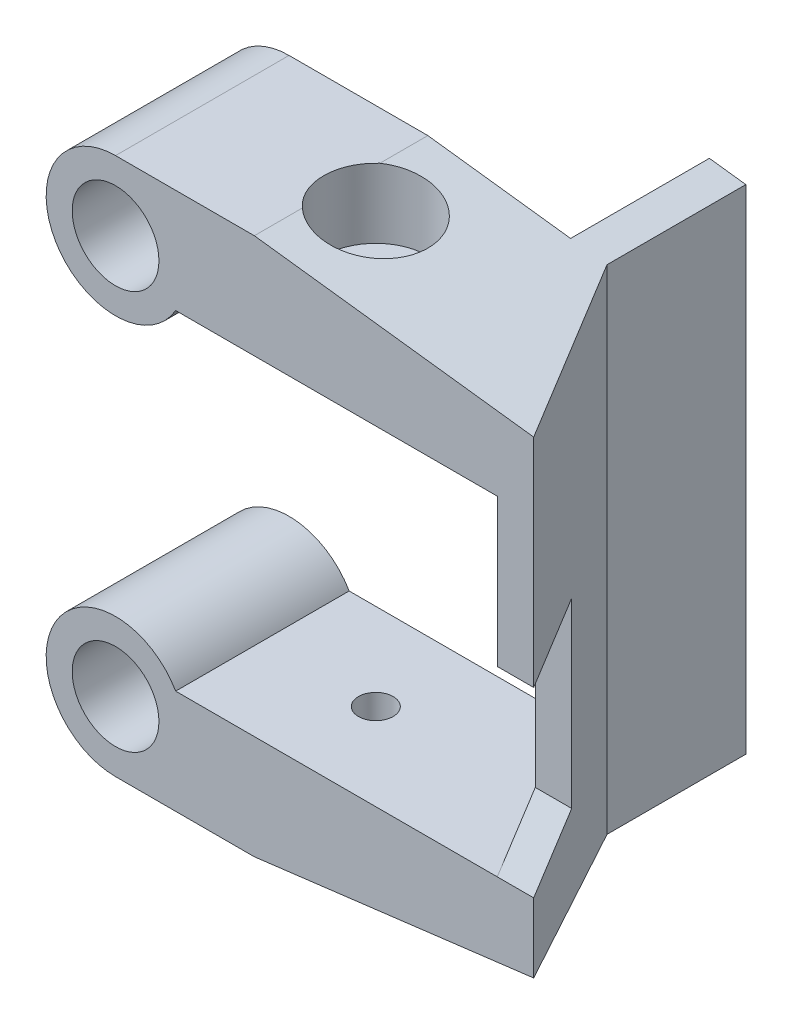
from build123d import *

# Parameters (mm, degrees)
CROQUIS1_R              = 2.5
SALIENTE_EXTRUIR1_DEPTH = 10
CROQUIS2_R              = 1
CORTAR_EXTRUIR1_DEPTH   = 4
CROQUIS3_R              = 3
CORTAR_EXTRUIR2_DEPTH   = 2
SALIENTE_EXTRUIR2_DEPTH = 13.5
SALIENTE_EXTRUIR3_START = 2
CROQUIS6_R              = 3
SALIENTE_EXTRUIR3_DEPTH = 2
CORTAR_EXTRUIR3_DEPTH   = 10
SALIENTE_EXTRUIR4_DEPTH = 8
CORTAR_EXTRUIR4_START   = 19.005770124
CORTAR_EXTRUIR4_DEPTH   = 5.094229876
CORTAR_EXTRUIR5_DEPTH   = 1


# Read off the part's stored shape, not the designer's step: Cortar-Extruir4
with BuildPart() as part:
    # Croquis1 → Saliente-Extruir1 (new body)
    with BuildSketch(Plane.XY):
        with BuildLine():
            Line((3.464101615, 3.5), (22, 3.5))
            Line((22, 3.5), (22, -0.5))
            Line((22, -0.5), (6, -0.5))
            Line((6, -0.5), (6, -2.5))
            Line((6, -2.5), (0, -2.5))
            ThreePointArc((0, -2.5), (-3.464101615, 3.5), (3.464101615, 3.5))
        make_face()
        with Locations((0, 1.5)):
            Circle(CROQUIS1_R, mode=Mode.SUBTRACT)
    extrude(amount=SALIENTE_EXTRUIR1_DEPTH)

    # Croquis2 → Cortar-Extruir1 (cut)
    with BuildSketch(Plane.XZ.offset(0.5)):
        with Locations(Location((10, 5, 0), (0, 0, 270))):
            Circle(CROQUIS2_R)
        Polygon((22, 10), (16.226497308, 0), (22, 0), align=None)
    extrude(amount=-CORTAR_EXTRUIR1_DEPTH, mode=Mode.SUBTRACT)

    # Croquis3 → Cortar-Extruir2 (cut)
    with BuildSketch(Plane.XZ.offset(0.5)):
        with Locations(Location((10, 5, 0), (0, 0, 270))):
            Circle(CROQUIS3_R)
    extrude(amount=-CORTAR_EXTRUIR2_DEPTH, mode=Mode.SUBTRACT)

    # Croquis4 → Saliente-Extruir2 (add)
    with BuildSketch(Plane.XZ.offset(0.5)):
        Polygon((22, 10), (24.1, 10), (18.326497308, 0), (16.226497308, 0), align=None)
    extrude(amount=-SALIENTE_EXTRUIR2_DEPTH)

    # Croquis6 → Saliente-Extruir3 (add)
    with BuildSketch(Plane.XZ.offset(0.5).offset(SALIENTE_EXTRUIR3_START)):
        Polygon((6, 10), (6, 0), (18.326497308, 0), (24.1, 10), align=None)
        with Locations(Location((10, 5, 0), (0, 0, 270))):
            Circle(CROQUIS6_R, mode=Mode.SUBTRACT)
    extrude(amount=-SALIENTE_EXTRUIR3_DEPTH)

    # Croquis7 → Cortar-Extruir3 (cut)
    with BuildSketch(Plane.XY.offset(10)):
        Polygon((24.1, -0.5), (8, -2.5), (24.1, -2.5), align=None)
    extrude(amount=-CORTAR_EXTRUIR3_DEPTH, mode=Mode.SUBTRACT)

    # Croquis8 → Saliente-Extruir4 (add)
    with BuildSketch(Plane(origin=(0, 0, 0), x_dir=(-1, 0, 0), z_dir=(0, 0, -1))):
        Polygon((-16.226497308, 13), (-18.326497308, 13), (-18.326497308, -1.217205303), (-16.226497308, -1.478074869), align=None)
    extrude(amount=SALIENTE_EXTRUIR4_DEPTH)

    # Simetría1: part across plane


with BuildPart() as part_1:
    add(part.part)
    add(part.part.mirror(Plane.ZX.offset(13)))

    # Cortar-Extruir4 outline → Cortar-Extruir4 (cut)
    with BuildSketch(Plane.YZ.offset(CORTAR_EXTRUIR4_START)):
        Polygon((3.871954022, 4.813841725), (14.371954022, 4.813841725), (14, 10), (3.5, 10), align=None)
    extrude(amount=CORTAR_EXTRUIR4_DEPTH, mode=Mode.SUBTRACT)

    # Croquis10 → Cortar-Extruir5 (cut)
    # profile 1 of 3: a face of its own
    with BuildSketch(Plane.XZ.offset(2.5)):
        with BuildLine():
            Line((0.93893851, 8.061465511), (0.624835946, 8.061465511))
            add(Edge.make_bspline(
                [(0.624835946, 8.061465511), (0.629974339, 8.091008734), (0.640098474, 8.149217504), (0.663168518, 8.233619406), (0.693890136, 8.31334783), (0.729855851, 8.389374725), (0.77397113, 8.460341308), (0.823569151, 8.527515757), (0.881199455, 8.589213597), (0.943781652, 8.647142725), (1.011267113, 8.699749333), (1.083372869, 8.74442066), (1.157885638, 8.783469404), (1.235775022, 8.815163541), (1.31697886, 8.838710682), (1.400592637, 8.85642678), (1.48740102, 8.867224), (1.54631294, 8.868506113), (1.576258221, 8.869157819)],
                knots=[0, 0, 0, 0, 1.053304757, 2.075317675, 3.068179183, 4.052514018, 5.025721787, 5.999656851, 6.981831287, 7.987213101, 8.994102963, 9.982949043, 10.963611807, 11.947192756, 12.931972798, 13.930523328, 14.948072636, 16, 16, 16, 16], degree=3))
            add(Edge.make_bspline(
                [(1.576258221, 8.869157819), (1.607849412, 8.868337596), (1.669858711, 8.866727609), (1.760664018, 8.85442526), (1.84726396, 8.835237206), (1.929477522, 8.806775963), (2.007089599, 8.770284416), (2.080961345, 8.72633159), (2.150619484, 8.674519652), (2.21443137, 8.614026389), (2.273438454, 8.548590787), (2.325098871, 8.477592336), (2.367371584, 8.401308099), (2.404054713, 8.321765516), (2.431060952, 8.236909756), (2.450848297, 8.147774097), (2.461883194, 8.05402824), (2.463669481, 7.990211824), (2.464579535, 7.957699485)],
                knots=[0, 0, 0, 0, 1.062315377, 2.085183558, 3.076853664, 4.041450855, 5.005054491, 5.956881831, 6.928532668, 7.918549963, 8.909565511, 9.889228988, 10.864308296, 11.838912148, 12.830831495, 13.853185998, 14.906269772, 16, 16, 16, 16], degree=3))
            add(Edge.make_bspline(
                [(2.464579535, 7.957699485), (2.463116795, 7.915300966), (2.460274509, 7.832915369), (2.437793048, 7.714206426), (2.399556512, 7.605209763), (2.354841164, 7.522096328), (2.310374191, 7.460727421), (2.271557279, 7.415828038), (2.227393375, 7.371636324), (2.177390877, 7.328856679), (2.121657913, 7.287495806), (2.060599984, 7.247148694), (1.99461627, 7.206562654), (1.947553936, 7.182191469), (1.92331351, 7.169638588)],
                knots=[0, 0, 0, 0, 1.499598844, 2.913907084, 4.255683563, 5.573052951, 6.236393449, 6.934250511, 7.671053759, 8.445154725, 9.260560518, 10.125260916, 11.034376938, 12, 12, 12, 12], degree=3))
            add(Edge.make_bspline(
                [(1.92331351, 7.169638588), (1.959233109, 7.145233398), (2.029395336, 7.097562418), (2.121912212, 7.013455328), (2.199538538, 6.921370005), (2.264524206, 6.822750081), (2.313572277, 6.715412989), (2.34974653, 6.60110216), (2.370969298, 6.478884654), (2.373528778, 6.394981352), (2.374835946, 6.352130575)],
                knots=[0, 0, 0, 0, 1.064624726, 2.079545519, 3.056122326, 4.013672591, 4.968126873, 5.942090367, 6.948992187, 8, 8, 8, 8], degree=3))
            add(Edge.make_bspline(
                [(2.374835946, 6.352130575), (2.372951048, 6.300812434), (2.36922834, 6.199458148), (2.339403877, 6.050347696), (2.290644048, 5.907158178), (2.223486846, 5.770520785), (2.138635562, 5.643878593), (2.038496205, 5.529007813), (1.922317264, 5.428948838), (1.792905422, 5.343764731), (1.653463441, 5.275250986), (1.506916129, 5.225768888), (1.354806806, 5.195153842), (1.251313153, 5.191510381), (1.199054696, 5.189670639)],
                knots=[0, 0, 0, 0, 1.004874671, 1.984646221, 2.966438109, 3.961709977, 4.958676373, 5.945134406, 6.938497793, 7.953256374, 8.973116323, 9.973725145, 10.976845487, 12, 12, 12, 12], degree=3))
            add(Edge.make_bspline(
                [(1.199054696, 5.189670639), (1.165832854, 5.190507601), (1.100573883, 5.192151679), (1.004559463, 5.204274263), (0.91247804, 5.224446776), (0.824180744, 5.253411912), (0.739975204, 5.290705099), (0.659339856, 5.335857332), (0.582972319, 5.389378235), (0.510561471, 5.450257408), (0.444148699, 5.518902365), (0.38427227, 5.594281029), (0.331495652, 5.67602942), (0.285883283, 5.764111158), (0.247186821, 5.858136921), (0.216630047, 5.958748464), (0.191662112, 6.065265565), (0.181374125, 6.13911863), (0.176117997, 6.176850126)],
                knots=[0, 0, 0, 0, 1.015592156, 1.994967694, 2.953714725, 3.89374535, 4.831137841, 5.76533834, 6.714853956, 7.678276274, 8.653576723, 9.630054425, 10.617115938, 11.623871201, 12.658910274, 13.721192194, 14.835758172, 16, 16, 16, 16], degree=3))
            Line((0.176117997, 6.176850126), (0.490220561, 6.176850126))
            add(Edge.make_bspline(
                [(0.490220561, 6.176850126), (0.497040066, 6.137680467), (0.509892115, 6.063861265), (0.538014089, 5.961531168), (0.570954337, 5.873556315), (0.611701031, 5.799048393), (0.661176422, 5.735216424), (0.719783483, 5.679156323), (0.788329897, 5.628889807), (0.864972279, 5.584979951), (0.947647633, 5.548083284), (1.034249656, 5.523879086), (1.122141028, 5.506036602), (1.181668268, 5.504531765), (1.211674888, 5.503773203)],
                knots=[0, 0, 0, 0, 1.310091687, 2.469000878, 3.493463796, 4.400459837, 5.257309936, 6.145490497, 7.065451012, 8.052643887, 9.053215749, 10.040649124, 11.012326184, 12, 12, 12, 12], degree=3))
            add(Edge.make_bspline(
                [(1.211674888, 5.503773203), (1.238597511, 5.504602376), (1.291773607, 5.506240114), (1.370450603, 5.518713672), (1.447016827, 5.538298922), (1.521916955, 5.565644483), (1.594356841, 5.602066821), (1.665280581, 5.645276658), (1.733536607, 5.697299459), (1.799494815, 5.755319564), (1.860068549, 5.818798356), (1.913814327, 5.884758638), (1.958972289, 5.952665305), (1.996883838, 6.021985519), (2.024341568, 6.094237738), (2.046210619, 6.167129776), (2.058116823, 6.242365936), (2.059856347, 6.292965433), (2.060733382, 6.318476729)],
                knots=[0, 0, 0, 0, 0.998765887, 1.972707914, 2.948771611, 3.928374012, 4.925217491, 5.953083336, 7.006002037, 8.105848567, 9.210029586, 10.258437752, 11.259122355, 12.233064382, 13.183315866, 14.122098927, 15.053198292, 16, 16, 16, 16], degree=3))
            add(Edge.make_bspline(
                [(2.060733382, 6.318476729), (2.059522921, 6.351280565), (2.057124568, 6.416276664), (2.037890817, 6.511589386), (2.004915129, 6.602440739), (1.960253791, 6.688491257), (1.903835241, 6.768053519), (1.834684637, 6.83724714), (1.755246554, 6.897149426), (1.663368987, 6.945702691), (1.55864559, 6.983705207), (1.439986475, 7.01058645), (1.306519998, 7.026430341), (1.21265571, 7.028385903), (1.163297484, 7.029414229)],
                knots=[0, 0, 0, 0, 0.91172544, 1.806453237, 2.690400502, 3.591501907, 4.495060705, 5.391179975, 6.301027311, 7.251780241, 8.269539355, 9.39038931, 10.627744823, 12, 12, 12, 12], degree=3))
            Line((1.163297484, 7.029414229), (1.201158061, 7.343516793))
            Line((1.201158061, 7.343516793), (1.293706138, 7.340712306))
            add(Edge.make_bspline(
                [(1.293706138, 7.340712306), (1.324811868, 7.341178226), (1.385761775, 7.342091169), (1.475077644, 7.35138343), (1.559901485, 7.366738652), (1.640108279, 7.387741218), (1.715622717, 7.414220123), (1.786280526, 7.44743607), (1.852291997, 7.486939984), (1.913684775, 7.531369364), (1.968915048, 7.580397423), (2.017506686, 7.632116807), (2.058591616, 7.686673267), (2.092526981, 7.743112995), (2.117845607, 7.80253954), (2.137066983, 7.863471046), (2.148690203, 7.927343696), (2.149875586, 7.970739426), (2.150476971, 7.992755575)],
                knots=[0, 0, 0, 0, 1.24628212, 2.442018811, 3.593922291, 4.698034728, 5.761554064, 6.796478033, 7.821307851, 8.840472263, 9.829094753, 10.776759556, 11.679673515, 12.561550013, 13.408929098, 14.262137482, 15.118322481, 16, 16, 16, 16], degree=3))
            add(Edge.make_bspline(
                [(2.150476971, 7.992755575), (2.149879643, 8.012172686), (2.148708953, 8.050227808), (2.141207508, 8.106314914), (2.126751398, 8.159707011), (2.107933167, 8.210950127), (2.084015792, 8.260171058), (2.05339587, 8.306215709), (2.018256976, 8.350816229), (1.977717433, 8.39245815), (1.933515781, 8.430681976), (1.886143137, 8.463770969), (1.836720561, 8.492121465), (1.784693356, 8.515504162), (1.729560582, 8.53290078), (1.672056357, 8.545412394), (1.61223344, 8.553350819), (1.571608636, 8.554481942), (1.551017837, 8.555055255)],
                knots=[0, 0, 0, 0, 1.017722485, 1.994609554, 2.957110515, 3.910372255, 4.852475095, 5.817233168, 6.802300924, 7.824362143, 8.857880086, 9.860231714, 10.847656914, 11.840006958, 12.84318132, 13.87138813, 14.921106966, 16, 16, 16, 16], degree=3))
            add(Edge.make_bspline(
                [(1.551017837, 8.555055255), (1.513243587, 8.553522788), (1.439376671, 8.550526074), (1.332798148, 8.524553384), (1.234376121, 8.481877703), (1.145539315, 8.423108063), (1.068727227, 8.350229513), (1.007322387, 8.26475368), (0.962853522, 8.167415855), (0.947042682, 8.097369313), (0.93893851, 8.061465511)],
                knots=[0, 0, 0, 0, 1.055739269, 2.064480543, 3.048501583, 4.044208126, 5.029380081, 5.994799901, 6.972193286, 8, 8, 8, 8], degree=3))
        make_face()
    # profile 2 of 3: a face of its own
    with BuildSketch(Plane.XZ.offset(2.5)):
        with BuildLine():
            add(Edge.make_bspline(
                [(4.355505016, 8.869157819), (4.388059863, 8.868069527), (4.452174428, 8.865926212), (4.546084688, 8.849259248), (4.636114186, 8.822600306), (4.721893143, 8.784634397), (4.80325974, 8.735154132), (4.881575795, 8.676542088), (4.954406772, 8.605227358), (5.023833004, 8.525051913), (5.087046416, 8.434618584), (5.14158594, 8.334205801), (5.18891997, 8.225299094), (5.226405985, 8.106766331), (5.255694149, 7.979663836), (5.276533299, 7.843513602), (5.289236946, 7.698527531), (5.290734177, 7.598751842), (5.291502612, 7.547543235)],
                knots=[0, 0, 0, 0, 0.862726717, 1.699081786, 2.520498053, 3.347202637, 4.178215295, 5.040763974, 5.93476699, 6.875030527, 7.849681161, 8.853576535, 9.899908318, 10.99336013, 12.144709661, 13.354978701, 14.642476391, 16, 16, 16, 16], degree=3))
            add(Edge.make_bspline(
                [(5.291502612, 7.547543235), (5.290873113, 7.48792938), (5.289630393, 7.370243338), (5.27844128, 7.196036781), (5.262390013, 7.026314147), (5.237343526, 6.861506232), (5.206768114, 6.701159816), (5.168931348, 6.545532105), (5.124141942, 6.394545984), (5.072313538, 6.249432554), (5.015983852, 6.112062685), (4.957281718, 5.983483243), (4.89474633, 5.866042629), (4.830722298, 5.757890303), (4.762162722, 5.661295934), (4.69274256, 5.573424163), (4.618471791, 5.497715654), (4.542605395, 5.431205347), (4.46425206, 5.374453633), (4.384960754, 5.324927813), (4.30402141, 5.283826665), (4.222455101, 5.248523157), (4.138565768, 5.222972575), (4.053718339, 5.204137373), (3.96747482, 5.191253787), (3.909404353, 5.190201071), (3.880144439, 5.189670639)],
                knots=[0, 0, 0, 0, 1.417840176, 2.799013713, 4.150912842, 5.471708405, 6.7625667, 8.032669517, 9.279703417, 10.506991142, 11.696233478, 12.810550062, 13.867435083, 14.859899853, 15.797607937, 16.683162267, 17.520520521, 18.316460938, 19.08034531, 19.819286053, 20.537807717, 21.237833669, 21.930604121, 22.619796651, 23.304558187, 24, 24, 24, 24], degree=3))
            add(Edge.make_bspline(
                [(3.880144439, 5.189670639), (3.836998162, 5.1913878), (3.752421184, 5.194753846), (3.629647003, 5.222286862), (3.514709871, 5.266793382), (3.425784602, 5.318432914), (3.359981415, 5.368653827), (3.312593927, 5.410839063), (3.268567491, 5.458209249), (3.22646348, 5.509514173), (3.186183674, 5.564950328), (3.149190381, 5.625679866), (3.114157939, 5.690674589), (3.081900383, 5.760453989), (3.052075978, 5.834856148), (3.027110654, 5.91485138), (3.006160797, 6.000141255), (2.9888237, 6.090494726), (2.974689216, 6.185903482), (2.964989903, 6.286522468), (2.95949358, 6.39249974), (2.958618066, 6.465004749), (2.958169279, 6.502170639)],
                knots=[0, 0, 0, 0, 1.435486142, 2.813894703, 4.16658029, 5.526677663, 6.22086169, 6.92078, 7.636484549, 8.371846828, 9.129958256, 9.916110108, 10.737818826, 11.587357994, 12.474660306, 13.405010476, 14.375161658, 15.397738152, 16.467494513, 17.58566334, 18.762416952, 20, 20, 20, 20], degree=3))
            add(Edge.make_bspline(
                [(2.958169279, 6.502170639), (2.958865674, 6.564116822), (2.960235698, 6.685984109), (2.970360627, 6.865826051), (2.986109, 7.039663223), (3.009073804, 7.207455853), (3.03967935, 7.368932488), (3.074965111, 7.524963437), (3.11761059, 7.675059131), (3.167466978, 7.818273174), (3.221759595, 7.953407837), (3.279380444, 8.079604938), (3.339910015, 8.196032674), (3.404482116, 8.302030016), (3.471833081, 8.398126528), (3.54278095, 8.483796956), (3.616461422, 8.560222791), (3.693787229, 8.626268002), (3.773613724, 8.682691864), (3.853281045, 8.733323779), (3.935141247, 8.77435652), (4.017171393, 8.809121265), (4.100426795, 8.836103417), (4.184753616, 8.854619434), (4.269805581, 8.867523895), (4.32694524, 8.868613305), (4.355505016, 8.869157819)],
                knots=[0, 0, 0, 0, 1.470791388, 2.893501234, 4.275600723, 5.614434664, 6.912857095, 8.17686219, 9.411686231, 10.615561684, 11.775855534, 12.868421853, 13.908428417, 14.889627493, 15.813393228, 16.692284126, 17.528148069, 18.331072678, 19.102586731, 19.8478506, 20.570031765, 21.273923614, 21.961841481, 22.644389209, 23.322433117, 24, 24, 24, 24], degree=3))
        make_face()
        with BuildLine():
            add(Edge.make_bspline(
                [(4.331666875, 8.555055255), (4.312692399, 8.554335183), (4.274498697, 8.552885752), (4.216987949, 8.542346785), (4.158617191, 8.526407312), (4.099329033, 8.50278295), (4.039549291, 8.472560878), (3.978520016, 8.436429583), (3.916971319, 8.393478294), (3.854524929, 8.344050338), (3.793356503, 8.286295246), (3.734454584, 8.220191684), (3.678121663, 8.145430069), (3.625035999, 8.061429946), (3.57377385, 7.968829499), (3.525719425, 7.867042696), (3.48020083, 7.756795691), (3.43764131, 7.638419264), (3.398295246, 7.512994087), (3.364946719, 7.380647543), (3.335978434, 7.242703344), (3.313470063, 7.098450591), (3.293857729, 6.948697019), (3.281987693, 6.792820217), (3.273919754, 6.631262547), (3.272827948, 6.521579004), (3.272271843, 6.465712306)],
                knots=[0, 0, 0, 0, 0.535590216, 1.078088953, 1.646503504, 2.242120821, 2.876684528, 3.536551845, 4.243209066, 4.994585865, 5.783597611, 6.615574094, 7.492013341, 8.4238755, 9.419375135, 10.479150357, 11.600588305, 12.786362483, 14.030464638, 15.311003394, 16.63899601, 18.009344201, 19.432868756, 20.902802065, 22.422459604, 24, 24, 24, 24], degree=3))
            add(Edge.make_bspline(
                [(3.272271843, 6.465712306), (3.272737165, 6.426195177), (3.273635908, 6.349870101), (3.282582447, 6.23923113), (3.294951715, 6.136228248), (3.314964073, 6.041478117), (3.339059573, 5.954189748), (3.369950634, 5.875211985), (3.405592361, 5.803505356), (3.447166989, 5.740266455), (3.492787274, 5.684797454), (3.541462394, 5.636638548), (3.592815964, 5.595897175), (3.646321147, 5.561633529), (3.702919027, 5.535391686), (3.762418731, 5.517347512), (3.824288709, 5.505546373), (3.866535277, 5.504367946), (3.887856779, 5.503773203)],
                knots=[0, 0, 0, 0, 1.484932994, 2.868063245, 4.170070992, 5.381165891, 6.504504114, 7.56970386, 8.563591869, 9.508896032, 10.407542569, 11.258515368, 12.077514383, 12.867109075, 13.641358872, 14.41376278, 15.199438864, 16, 16, 16, 16], degree=3))
            add(Edge.make_bspline(
                [(3.887856779, 5.503773203), (3.910105066, 5.504400054), (3.954653206, 5.505655208), (4.021012901, 5.517376097), (4.086453159, 5.536537197), (4.151244324, 5.562665455), (4.215518334, 5.596034703), (4.279351618, 5.636543931), (4.34169406, 5.685770608), (4.4040879, 5.74066751), (4.4643629, 5.80324407), (4.52172075, 5.872652307), (4.575797961, 5.948599354), (4.626153878, 6.031065088), (4.673958733, 6.119396622), (4.718004593, 6.214288529), (4.758863059, 6.315660137), (4.782827145, 6.386128677), (4.795108382, 6.422242755)],
                knots=[0, 0, 0, 0, 0.77604706, 1.553892808, 2.343877876, 3.152800139, 3.98830987, 4.868615572, 5.78728157, 6.75807329, 7.767676272, 8.816335789, 9.898351881, 11.019038633, 12.187032868, 13.402327443, 14.668731489, 16, 16, 16, 16], degree=3))
            add(Edge.make_bspline(
                [(4.795108382, 6.422242755), (4.809760777, 6.468632726), (4.839182801, 6.56178383), (4.87622479, 6.704026353), (4.906626079, 6.848757551), (4.933236689, 6.995453295), (4.952164185, 7.144836257), (4.967391568, 7.29628087), (4.975752044, 7.450225296), (4.976847653, 7.553610513), (4.977400048, 7.605736344)],
                knots=[0, 0, 0, 0, 0.97088093, 1.949529747, 2.93210591, 3.92216045, 4.924261898, 5.936559817, 6.959633308, 8, 8, 8, 8], degree=3))
            add(Edge.make_bspline(
                [(4.977400048, 7.605736344), (4.976883019, 7.644078768), (4.975882302, 7.718291053), (4.967593179, 7.826048559), (4.952967779, 7.926295192), (4.932719933, 8.019356512), (4.907033544, 8.105070908), (4.875524477, 8.183325642), (4.838305805, 8.254315485), (4.794785694, 8.317270339), (4.746855468, 8.372765819), (4.696212, 8.421429327), (4.64311105, 8.46335816), (4.586208523, 8.496401556), (4.52678098, 8.522765371), (4.464401297, 8.541569265), (4.398950746, 8.553328917), (4.354387061, 8.554472311), (4.331666875, 8.555055255)],
                knots=[0, 0, 0, 0, 1.430250887, 2.768270117, 4.028380119, 5.206661668, 6.318152812, 7.362403216, 8.349129852, 9.30195703, 10.210727286, 11.080171321, 11.919002126, 12.727940788, 13.528188044, 14.339050687, 15.153187666, 16, 16, 16, 16], degree=3))
        make_face(mode=Mode.SUBTRACT)
    # profile 3 of 3: a face of its own
    with BuildSketch(Plane.XZ.offset(2.5)):
        with BuildLine():
            add(Edge.make_bspline(
                [(6.539499407, 8.869157819), (6.562901292, 8.868430082), (6.609209602, 8.866990016), (6.67719874, 8.857195769), (6.742362302, 8.840305806), (6.804285148, 8.81618024), (6.863816543, 8.78578802), (6.920447327, 8.748640689), (6.974287912, 8.70472453), (7.024106434, 8.654334892), (7.070815613, 8.599402935), (7.110336265, 8.538662177), (7.145367844, 8.474508352), (7.173287951, 8.405826271), (7.194185464, 8.332847425), (7.209501625, 8.255941945), (7.219818834, 8.174858368), (7.22059488, 8.119223825), (7.220989792, 8.090912626)],
                knots=[0, 0, 0, 0, 0.970717871, 1.920883944, 2.842680434, 3.757311267, 4.672198984, 5.610669493, 6.561577208, 7.54876171, 8.546788736, 9.547073532, 10.549095219, 11.575307918, 12.615394826, 13.693467145, 14.826256018, 16, 16, 16, 16], degree=3))
            add(Edge.make_bspline(
                [(7.220989792, 8.090912626), (7.220481139, 8.057917544), (7.219485517, 7.993333952), (7.206840849, 7.898874959), (7.188063495, 7.808818583), (7.162358919, 7.722620827), (7.127885768, 7.641117782), (7.085334499, 7.564393081), (7.036336637, 7.491679995), (6.979574649, 7.424806923), (6.917492356, 7.364148365), (6.851572933, 7.310432199), (6.781461125, 7.265157537), (6.707906243, 7.228018803), (6.630646214, 7.198787465), (6.5499205, 7.178717749), (6.465554509, 7.166479371), (6.408197797, 7.164857078), (6.378942516, 7.164029614)],
                knots=[0, 0, 0, 0, 1.130854088, 2.213500164, 3.262022406, 4.283858738, 5.293169922, 6.29044296, 7.288617459, 8.29537939, 9.292942272, 10.261820963, 11.206697579, 12.149430033, 13.082848615, 14.033453143, 14.996945993, 16, 16, 16, 16], degree=3))
            add(Edge.make_bspline(
                [(6.378942516, 7.164029614), (6.355066135, 7.164711291), (6.30827602, 7.166047161), (6.239513864, 7.176350467), (6.173540384, 7.19203012), (6.110513784, 7.215469228), (6.051070915, 7.245804863), (5.994126118, 7.282029391), (5.940058126, 7.324747023), (5.890076866, 7.374394799), (5.844470178, 7.429049864), (5.804268568, 7.488077268), (5.770416902, 7.551547232), (5.743341577, 7.619178098), (5.721347839, 7.690154338), (5.705961669, 7.765275914), (5.696746811, 7.844351273), (5.695820538, 7.898546249), (5.695348766, 7.926149005)],
                knots=[0, 0, 0, 0, 0.998939331, 1.957603429, 2.904214697, 3.832710991, 4.764499105, 5.69253155, 6.653438724, 7.642559757, 8.635735374, 9.628718291, 10.626459594, 11.640042448, 12.673490826, 13.732455774, 14.845087277, 16, 16, 16, 16], degree=3))
            add(Edge.make_bspline(
                [(5.695348766, 7.926149005), (5.69624365, 7.959364854), (5.697994495, 8.024351815), (5.709195351, 8.119917885), (5.728710434, 8.211008923), (5.75642696, 8.297674476), (5.790545556, 8.380469207), (5.833757367, 8.458479372), (5.884449177, 8.532448244), (5.942324561, 8.601385916), (6.005632215, 8.663835623), (6.072228079, 8.719328786), (6.143042686, 8.764795742), (6.216061279, 8.803105674), (6.292463505, 8.832859368), (6.371969462, 8.853740013), (6.454696344, 8.866858279), (6.510937802, 8.868383336), (6.539499407, 8.869157819)],
                knots=[0, 0, 0, 0, 1.130922342, 2.21265473, 3.270805013, 4.297553847, 5.306888354, 6.314716204, 7.327776304, 8.355757729, 9.374178632, 10.352259942, 11.301297143, 12.233743801, 13.155811409, 14.086116658, 15.028055401, 16, 16, 16, 16], degree=3))
        make_face()
        with BuildLine():
            add(Edge.make_bspline(
                [(6.527580337, 8.599927049), (6.503420208, 8.599060007), (6.45529798, 8.597333028), (6.38403284, 8.580863396), (6.314336182, 8.55499144), (6.247374229, 8.518241337), (6.184233771, 8.473312351), (6.12819621, 8.418117548), (6.078651414, 8.354758719), (6.037881685, 8.282434451), (6.004787896, 8.204172975), (5.981710087, 8.120249677), (5.967430662, 8.031806516), (5.965541084, 7.971075577), (5.964579535, 7.94017144)],
                knots=[0, 0, 0, 0, 0.898823508, 1.790279833, 2.710439412, 3.660988812, 4.627551506, 5.588017192, 6.580694835, 7.614151002, 8.671642138, 9.738410943, 10.84914581, 12, 12, 12, 12], degree=3))
            add(Edge.make_bspline(
                [(5.964579535, 7.94017144), (5.965946256, 7.90359121), (5.968570013, 7.833366439), (5.991679975, 7.733483893), (6.031698991, 7.645600407), (6.085604078, 7.569804805), (6.152551126, 7.509449084), (6.22836915, 7.464568641), (6.313134342, 7.437606707), (6.37243858, 7.434731458), (6.402780657, 7.433260383)],
                knots=[0, 0, 0, 0, 1.167761783, 2.24180663, 3.250972385, 4.235329223, 5.192198183, 6.109164403, 7.032583837, 8, 8, 8, 8], degree=3))
            add(Edge.make_bspline(
                [(6.402780657, 7.433260383), (6.422916428, 7.433712295), (6.462239244, 7.434594827), (6.5198903, 7.444091236), (6.574404077, 7.45947391), (6.626204206, 7.480404108), (6.67444685, 7.508450095), (6.719924454, 7.541964387), (6.762466183, 7.581765166), (6.801206955, 7.627262478), (6.836627796, 7.676513482), (6.867785723, 7.728730421), (6.89389251, 7.783652587), (6.914478958, 7.841135077), (6.931831924, 7.900483637), (6.943541308, 7.962459707), (6.950742447, 8.026937132), (6.95141716, 8.07079445), (6.951759023, 8.093015992)],
                knots=[0, 0, 0, 0, 1.007750251, 1.968018882, 2.916659645, 3.840494567, 4.758079246, 5.703899357, 6.664595947, 7.668873183, 8.692139613, 9.699889865, 10.710423493, 11.732484109, 12.755080818, 13.804198226, 14.88743536, 16, 16, 16, 16], degree=3))
            add(Edge.make_bspline(
                [(6.951759023, 8.093015992), (6.950463841, 8.130320179), (6.947991878, 8.201518368), (6.924332546, 8.301877862), (6.886601963, 8.390704058), (6.832015802, 8.46477426), (6.767562372, 8.524948143), (6.694509431, 8.569184545), (6.613214978, 8.595361151), (6.556514492, 8.598384328), (6.527580337, 8.599927049)],
                knots=[0, 0, 0, 0, 1.207628711, 2.304861276, 3.322697533, 4.315405203, 5.264472711, 6.164993415, 7.063599473, 8, 8, 8, 8], degree=3))
        make_face(mode=Mode.SUBTRACT)
    extrude(amount=-CORTAR_EXTRUIR5_DEPTH, mode=Mode.SUBTRACT)


solid = part_1.part
